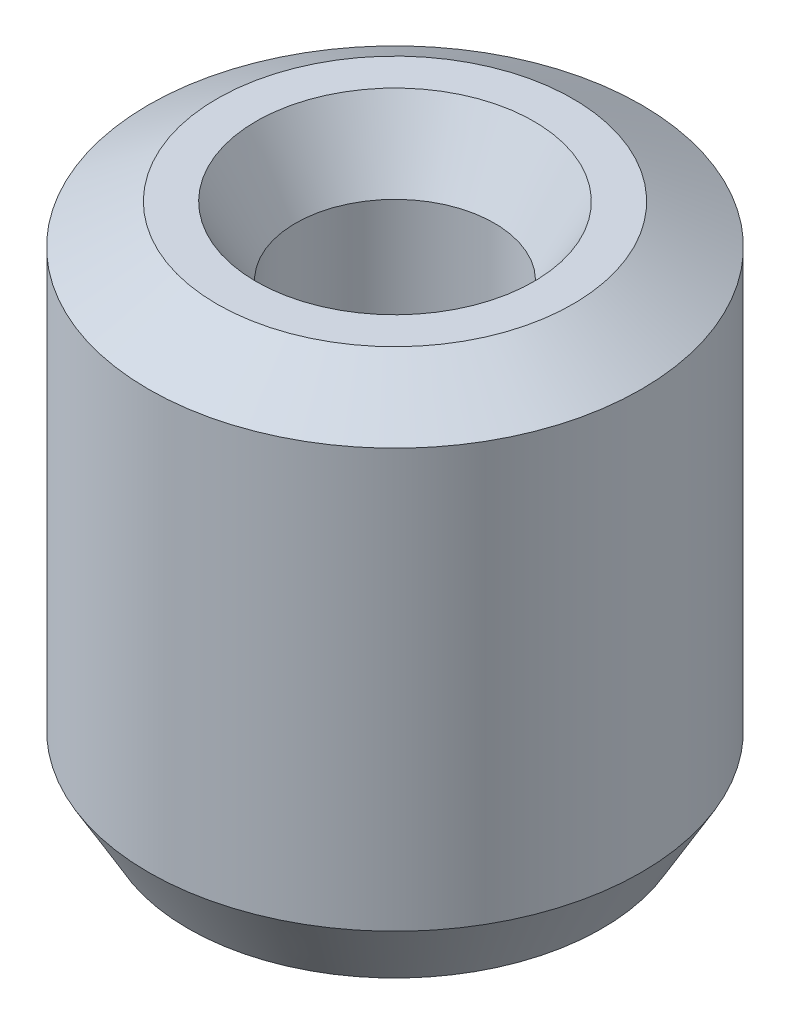
from build123d import *
from OCP.BRepFilletAPI import BRepFilletAPI_MakeChamfer

# Parameters (mm, degrees)
SKETCH1_R           = 17.5
BOSS_EXTRUDE1_DEPTH = 37.380566043
SKETCH2_R           = 7.056410203
CUT_EXTRUDE1_DEPTH  = 45.830867911
CHAMFER1_SIZE       = 2.806462098
CHAMFER1_SIZE2      = 4.860934944


with BuildPart() as part:
    # Sketch1 → Boss-Extrude1 (new body)
    with BuildSketch(Plane(origin=(0, 0, 0), x_dir=(1, 0, 0), z_dir=(0, 1, 0))):
        Circle(SKETCH1_R)
    extrude(amount=BOSS_EXTRUDE1_DEPTH)

    # Sketch2 → Cut-Extrude1 (cut, through all)
    with BuildSketch(Plane(origin=(0, 0, 0), x_dir=(1, 0, 0), z_dir=(0, 1, 0))):
        Circle(SKETCH2_R)
    extrude(amount=CUT_EXTRUDE1_DEPTH, mode=Mode.SUBTRACT)

    # Chamfer1: one chamfer whose edges measure the first distance from different faces: ONE call of the kernel's chamfer builder (chamfer() names one face for all edges)
    chamfer1_edges_1 = [part.edges().sort_by_distance(p)[0] for p in [
        (-7.056410203, 37.380566043, 0),
    ]]
    chamfer1_side_1 = [part.faces().sort_by_distance(p)[0] for p in [
        (-17.005025253, 37.380566043, 0),
    ]]
    chamfer1_edges_2 = [part.edges().sort_by_distance(p)[0] for p in [
        (-7.056410203, 0, 0),
    ]]
    chamfer1_side_2 = [part.faces().sort_by_distance(p)[0] for p in [
        (-7.056410203, 18.690283022, 0),
    ]]
    chamfer1_edges_3 = [part.edges().sort_by_distance(p)[0] for p in [
        (-17.5, 0, 0),
    ]]
    chamfer1_side_3 = [part.faces().sort_by_distance(p)[0] for p in [
        (-17.005025253, 0, 0),
    ]]
    chamfer1_edges_4 = [part.edges().sort_by_distance(p)[0] for p in [
        (-17.5, 37.380566043, 0),
    ]]
    chamfer1_side_4 = [part.faces().sort_by_distance(p)[0] for p in [
        (-17.5, 18.690283022, 0),
    ]]
    chamfer1 = BRepFilletAPI_MakeChamfer(part.part.solid().wrapped)
    for e in chamfer1_edges_1:
        chamfer1.Add(CHAMFER1_SIZE, CHAMFER1_SIZE2, e.wrapped, chamfer1_side_1[0].wrapped)  # the first distance lies on this face
    for e in chamfer1_edges_2:
        chamfer1.Add(CHAMFER1_SIZE, CHAMFER1_SIZE2, e.wrapped, chamfer1_side_2[0].wrapped)  # the first distance lies on this face
    for e in chamfer1_edges_3:
        chamfer1.Add(CHAMFER1_SIZE, CHAMFER1_SIZE2, e.wrapped, chamfer1_side_3[0].wrapped)  # the first distance lies on this face
    for e in chamfer1_edges_4:
        chamfer1.Add(CHAMFER1_SIZE, CHAMFER1_SIZE2, e.wrapped, chamfer1_side_4[0].wrapped)  # the first distance lies on this face
    add(Compound.cast(chamfer1.Shape()), mode=Mode.REPLACE)


solid = part.part
